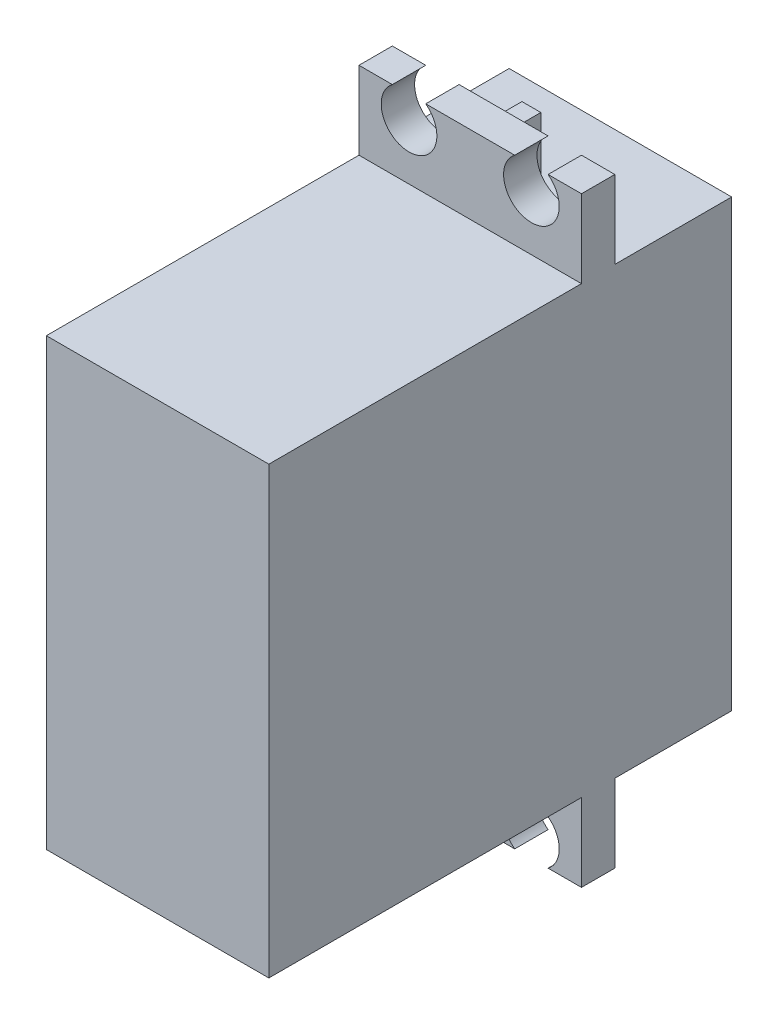
from build123d import *

# Parameters (mm, degrees)
SKETCH1_W           = 20
SKETCH1_H           = 40
BOSS_EXTRUDE1_DEPTH = 41.6
SKETCH2_R           = 3
SKETCH2_R_2         = 1.5
BOSS_EXTRUDE2_DEPTH = 4
BOSS_EXTRUDE3_START = -13.5
BOSS_EXTRUDE3_DEPTH = 3
SKETCH5_W           = 1.7
SKETCH5_H           = 6
BOSS_EXTRUDE4_DEPTH = 2.5


with BuildPart() as part:
    # Sketch1 → Boss-Extrude1 (new body)
    with BuildSketch(Plane.XY):
        Rectangle(SKETCH1_W, SKETCH1_H)
    extrude(amount=BOSS_EXTRUDE1_DEPTH)

    # Sketch2 → Boss-Extrude2 (add)
    with BuildSketch(Plane(origin=(0, 0, 0), x_dir=(-1, 0, 0), z_dir=(0, 0, -1))):
        with Locations((0, 10)):
            Circle(SKETCH2_R)
        with Locations((0, 10)):
            Circle(SKETCH2_R_2, mode=Mode.SUBTRACT)
    extrude(amount=BOSS_EXTRUDE2_DEPTH)

    # Sketch3 → Boss-Extrude3 (add)
    with BuildSketch(Plane(origin=(0, 0, 0), x_dir=(-1, 0, 0), z_dir=(0, 0, -1)).offset(BOSS_EXTRUDE3_START)):
        with BuildLine():
            Line((10, -20), (-10, -20))
            Line((-10, -20), (-10, -27))
            Line((-10, -27), (-7, -27))
            ThreePointArc((-7, -27), (-5.5, -22.5), (-4, -27))
            Line((-4, -27), (4, -27))
            ThreePointArc((4, -27), (5.5, -22.5), (7, -27))
            Line((7, -27), (10, -27))
            Line((10, -27), (10, -20))
        make_face()
        with BuildLine():
            Line((-10, 27), (-10, 20))
            Line((-10, 20), (10, 20))
            Line((10, 20), (10, 27))
            Line((10, 27), (7, 27))
            ThreePointArc((7, 27), (5.5, 22.5), (4, 27))
            Line((4, 27), (-4, 27))
            ThreePointArc((-4, 27), (-5.5, 22.5), (-7, 27))
            Line((-7, 27), (-10, 27))
        make_face()
    extrude(amount=BOSS_EXTRUDE3_DEPTH)

    # Sketch5 → Boss-Extrude4 (add)
    with BuildSketch(Plane(origin=(0, 0, 10.5), x_dir=(-1, 0, 0), z_dir=(0, 0, -1))):
        with Locations((0, 23)):
            Rectangle(SKETCH5_W, SKETCH5_H)
        with Locations((0, -23)):
            Rectangle(SKETCH5_W, SKETCH5_H)
    extrude(amount=BOSS_EXTRUDE4_DEPTH)


solid = part.part
